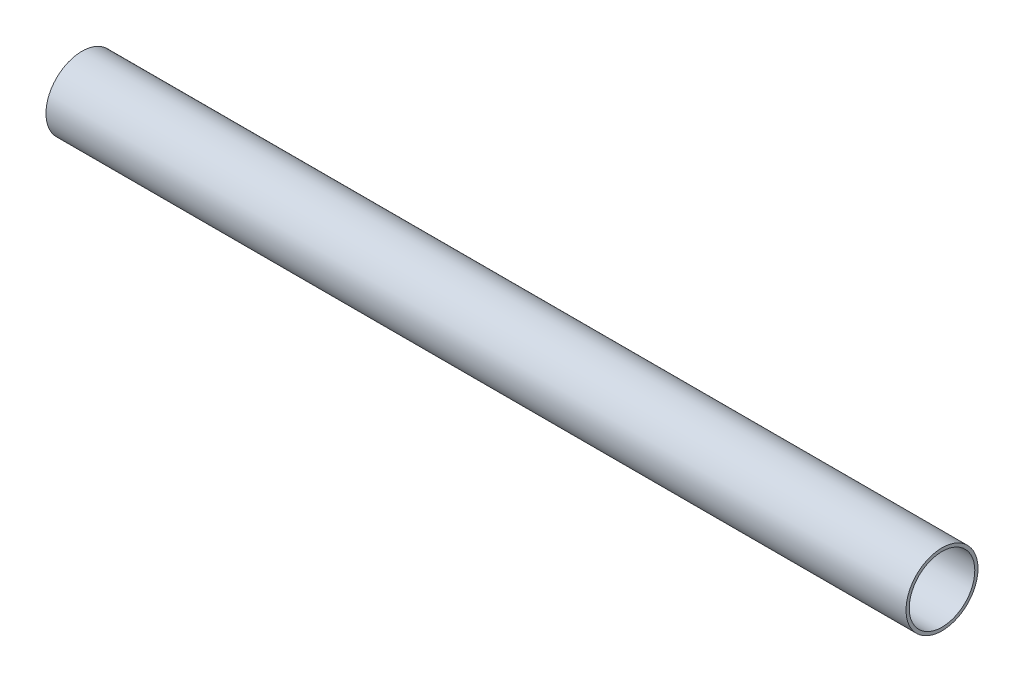
from build123d import *

# Parameters (mm, degrees)
SKIZZE1_R                       = 5.6
SKIZZE1_R_2                     = 5.1
AUFSATZ_LINEAR_AUSTRAGEN1_DEPTH = 133.8


with BuildPart() as part:
    # Skizze1 → Aufsatz-Linear austragen1 (new body)
    with BuildSketch(Plane(origin=(0, 0, 0), x_dir=(0, 0, -1), z_dir=(1, 0, 0))):
        Circle(SKIZZE1_R)
        Circle(SKIZZE1_R_2, mode=Mode.SUBTRACT)
    extrude(amount=AUFSATZ_LINEAR_AUSTRAGEN1_DEPTH)


solid = part.part
